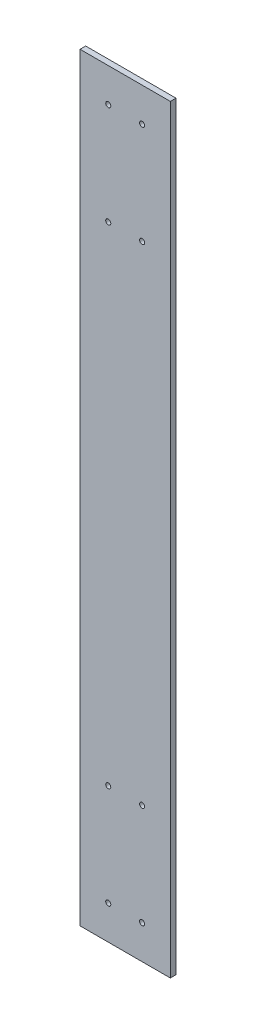
from build123d import *

# Parameters (mm, degrees)
SKETCH1_W           = 50.8
SKETCH1_H           = 3.175
BOSS_EXTRUDE1_DEPTH = 427.1518
SKETCH4_R           = 1.4224
CUT_EXTRUDE2_DEPTH  = 5.08
SKETCH5_W           = 12.58267919
SKETCH5_H           = 101.029760921
BOSS_EXTRUDE2_DEPTH = 3.175
SKETCH6_W           = 7.546607927
SKETCH6_H           = 108.671154153
SKETCH6_W_2         = 9.055929513
BOSS_EXTRUDE3_DEPTH = 3.175
SKETCH7_W           = 50.8
SKETCH7_H           = 16.51
BOSS_EXTRUDE4_DEPTH = 3.175
SKETCH8_W           = 50.8
SKETCH8_H           = 51.188017092
BOSS_EXTRUDE5_DEPTH = 3.175
SKETCH9_W           = 50.8
SKETCH9_H           = 70.169066632
BOSS_EXTRUDE6_DEPTH = 3.175


with BuildPart() as part:
    # Sketch1 → Boss-Extrude1 (new body)
    with BuildSketch(Plane(origin=(0, 0, 0), x_dir=(1, 0, 0), z_dir=(0, 1, 0))):
        with Locations((0, 70.254548969)):
            Rectangle(SKETCH1_W, SKETCH1_H)
    extrude(amount=BOSS_EXTRUDE1_DEPTH)

    # Sketch4 → Cut-Extrude2 (cut)
    with BuildSketch(Plane.XY.offset(-68.667048969)):
        with Locations((-3.175, 376.3518)):
            Circle(SKETCH4_R)
        with Locations((-9.525, 376.3518)):
            Circle(SKETCH4_R)
        with Locations((-9.525, 370.0018)):
            Circle(SKETCH4_R)
        with Locations((-9.525, 363.6518)):
            Circle(SKETCH4_R)
        with Locations((-9.525, 357.3018)):
            Circle(SKETCH4_R)
        with Locations((-9.525, 350.9518)):
            Circle(SKETCH4_R)
        with Locations((-9.525, 344.6018)):
            Circle(SKETCH4_R)
        with Locations((-9.525, 338.2518)):
            Circle(SKETCH4_R)
        with Locations((-9.525, 331.9018)):
            Circle(SKETCH4_R)
        with Locations((-9.525, 325.5518)):
            Circle(SKETCH4_R)
        with Locations((-9.525, 319.2018)):
            Circle(SKETCH4_R)
        with Locations((-9.525, 312.8518)):
            Circle(SKETCH4_R)
        with Locations((-9.525, 306.5018)):
            Circle(SKETCH4_R)
        with Locations((-9.525, 300.1518)):
            Circle(SKETCH4_R)
        with Locations((-9.525, 293.8018)):
            Circle(SKETCH4_R)
        with Locations((-9.525, 287.4518)):
            Circle(SKETCH4_R)
        with Locations((-9.525, 281.1018)):
            Circle(SKETCH4_R)
        with Locations((-3.175, 370.0018)):
            Circle(SKETCH4_R)
        with Locations((-3.175, 363.6518)):
            Circle(SKETCH4_R)
        with Locations((-3.175, 357.3018)):
            Circle(SKETCH4_R)
        with Locations((-3.175, 350.9518)):
            Circle(SKETCH4_R)
        with Locations((-3.175, 344.6018)):
            Circle(SKETCH4_R)
        with Locations((-3.175, 338.2518)):
            Circle(SKETCH4_R)
        with Locations((-3.175, 331.9018)):
            Circle(SKETCH4_R)
        with Locations((-3.175, 325.5518)):
            Circle(SKETCH4_R)
        with Locations((-3.175, 319.2018)):
            Circle(SKETCH4_R)
        with Locations((-3.175, 312.8518)):
            Circle(SKETCH4_R)
        with Locations((-3.175, 306.5018)):
            Circle(SKETCH4_R)
        with Locations((-3.175, 300.1518)):
            Circle(SKETCH4_R)
        with Locations((-3.175, 293.8018)):
            Circle(SKETCH4_R)
        with Locations((-3.175, 287.4518)):
            Circle(SKETCH4_R)
        with Locations((-3.175, 281.1018)):
            Circle(SKETCH4_R)
        with Locations((3.175, 281.1018)):
            Circle(SKETCH4_R)
        with Locations((3.175, 287.4518)):
            Circle(SKETCH4_R)
        with Locations((3.175, 293.8018)):
            Circle(SKETCH4_R)
        with Locations((3.175, 300.1518)):
            Circle(SKETCH4_R)
        with Locations((3.175, 306.5018)):
            Circle(SKETCH4_R)
        with Locations((3.175, 312.8518)):
            Circle(SKETCH4_R)
        with Locations((3.175, 319.2018)):
            Circle(SKETCH4_R)
        with Locations((3.175, 325.5518)):
            Circle(SKETCH4_R)
        with Locations((3.175, 331.9018)):
            Circle(SKETCH4_R)
        with Locations((3.175, 338.2518)):
            Circle(SKETCH4_R)
        with Locations((3.175, 344.6018)):
            Circle(SKETCH4_R)
        with Locations((3.175, 350.9518)):
            Circle(SKETCH4_R)
        with Locations((3.175, 357.3018)):
            Circle(SKETCH4_R)
        with Locations((3.175, 363.6518)):
            Circle(SKETCH4_R)
        with Locations((3.175, 370.0018)):
            Circle(SKETCH4_R)
        with Locations((9.525, 281.1018)):
            Circle(SKETCH4_R)
        with Locations((9.525, 287.4518)):
            Circle(SKETCH4_R)
        with Locations((9.525, 293.8018)):
            Circle(SKETCH4_R)
        with Locations((9.525, 300.1518)):
            Circle(SKETCH4_R)
        with Locations((9.525, 306.5018)):
            Circle(SKETCH4_R)
        with Locations((9.525, 312.8518)):
            Circle(SKETCH4_R)
        with Locations((9.525, 319.2018)):
            Circle(SKETCH4_R)
        with Locations((9.525, 325.5518)):
            Circle(SKETCH4_R)
        with Locations((9.525, 331.9018)):
            Circle(SKETCH4_R)
        with Locations((9.525, 338.2518)):
            Circle(SKETCH4_R)
        with Locations((9.525, 344.6018)):
            Circle(SKETCH4_R)
        with Locations((9.525, 350.9518)):
            Circle(SKETCH4_R)
        with Locations((9.525, 357.3018)):
            Circle(SKETCH4_R)
        with Locations((9.525, 363.6518)):
            Circle(SKETCH4_R)
        with Locations((9.525, 370.0018)):
            Circle(SKETCH4_R)
        with Locations((9.525, 376.3518)):
            Circle(SKETCH4_R)
        with Locations((3.175, 376.3518)):
            Circle(SKETCH4_R)
        with Locations((-9.525, 382.7018)):
            Circle(SKETCH4_R)
        with Locations((9.525, 382.7018)):
            Circle(SKETCH4_R)
        with Locations((-9.525, 389.0518)):
            Circle(SKETCH4_R)
        with Locations((9.525, 389.0518)):
            Circle(SKETCH4_R)
        with Locations((-9.525, 395.4018)):
            Circle(SKETCH4_R)
        with Locations((9.525, 395.4018)):
            Circle(SKETCH4_R)
        with Locations((-9.525, 401.7518)):
            Circle(SKETCH4_R)
        with Locations((9.525, 401.7518)):
            Circle(SKETCH4_R)
        with Locations((-9.525, 408.1018)):
            Circle(SKETCH4_R)
        with Locations((9.525, 408.1018)):
            Circle(SKETCH4_R)
        with Locations((-9.525, 414.4518)):
            Circle(SKETCH4_R)
        with Locations((9.525, 414.4518)):
            Circle(SKETCH4_R)
    cut_extrude2 = extrude(amount=-CUT_EXTRUDE2_DEPTH, mode=Mode.SUBTRACT)

    # Sketch5 → Boss-Extrude2 (add)
    with BuildSketch(Plane.XY.offset(-68.667048969)):
        with Locations((-0.175223229, 328.362881378)):
            Rectangle(SKETCH5_W, SKETCH5_H)
    boss_extrude2 = extrude(amount=-BOSS_EXTRUDE2_DEPTH)

    # Sketch6 → Boss-Extrude3 (add)
    with BuildSketch(Plane.XY.offset(-68.667048969)):
        with Locations((-16.484092579, 326.705642943)):
            Rectangle(SKETCH6_W, SKETCH6_H)
        with Locations((16.9725359, 326.705642943)):
            Rectangle(SKETCH6_W_2, SKETCH6_H)
    boss_extrude3 = extrude(amount=-BOSS_EXTRUDE3_DEPTH)

    # Sketch7 → Boss-Extrude4 (add)
    with BuildSketch(Plane.XY.offset(-68.667048969)):
        with Locations((0, 418.8968)):
            Rectangle(SKETCH7_W, SKETCH7_H)
    boss_extrude4 = extrude(amount=-BOSS_EXTRUDE4_DEPTH)

    # Sketch8 → Boss-Extrude5 (add)
    with BuildSketch(Plane.XY.offset(-68.667048969)):
        with Locations((0, 379.332910144)):
            Rectangle(SKETCH8_W, SKETCH8_H)
    boss_extrude5 = extrude(amount=-BOSS_EXTRUDE5_DEPTH)

    # Sketch9 → Boss-Extrude6 (add)
    with BuildSketch(Plane.XY.offset(-68.667048969)):
        with Locations((0, 312.515447534)):
            Rectangle(SKETCH9_W, SKETCH9_H)
    boss_extrude6 = extrude(amount=-BOSS_EXTRUDE6_DEPTH)

    # Mirror1: Cut-Extrude2, Boss-Extrude2, Boss-Extrude3, Boss-Extrude4, Boss-Extrude5, Boss-Extrude6 across plane
    add(cut_extrude2.mirror(Plane.ZX.offset(213.5759)), mode=Mode.SUBTRACT)
    add(boss_extrude2.mirror(Plane.ZX.offset(213.5759)))
    add(boss_extrude3.mirror(Plane.ZX.offset(213.5759)))
    add(boss_extrude4.mirror(Plane.ZX.offset(213.5759)))
    add(boss_extrude5.mirror(Plane.ZX.offset(213.5759)))
    add(boss_extrude6.mirror(Plane.ZX.offset(213.5759)))


solid = part.part
